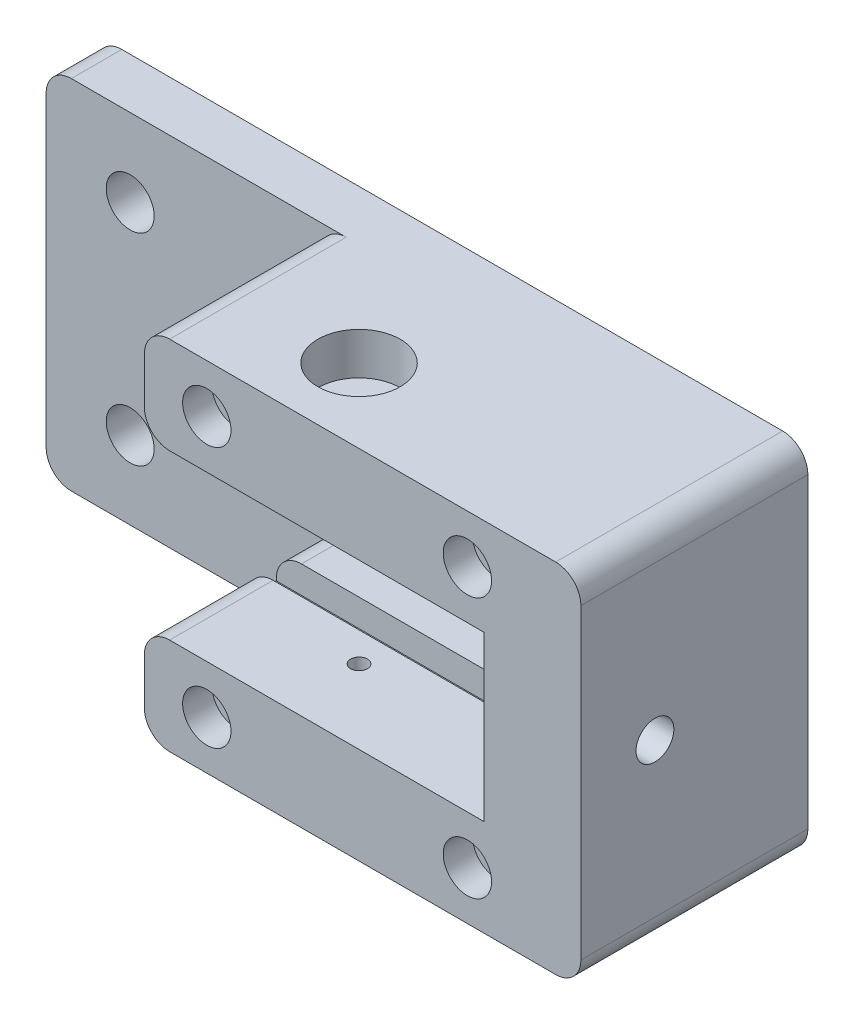
from build123d import *
from build123d.topology import SkipClean

# Parameters (mm, degrees)
SKETCH1_R           = 2.850000007
SKETCH1_R_2         = 1.725
BOSS_EXTRUDE1_DEPTH = 6
SKETCH7_R           = 11.125
CUT_EXTRUDE4_DEPTH  = 2.5
SKETCH8_R           = 7.5
CUT_EXTRUDE5_DEPTH  = 6
SKETCH10_R          = 1.725
BOSS_EXTRUDE4_DEPTH = 21
SKETCH11_W          = 3.38
SKETCH11_H          = 26
CUT_EXTRUDE6_DEPTH  = 40.422308
SKETCH14_R          = 1
CUT_EXTRUDE7_DEPTH  = 70.377273429
CHAMFER1_SIZE       = 3
SKETCH19_R          = 4.9
SKETCH19_R_2        = 1
CUT_EXTRUDE9_DEPTH  = 5
SKETCH20_R          = 2.125
CUT_EXTRUDE10_DEPTH = 3
SKETCH21_R          = 2.875
CUT_EXTRUDE11_DEPTH = 3.5
SKETCH22_R          = 2.25
CUT_EXTRUDE12_DEPTH = 82.036885127
CHAMFER5_SIZE       = 3


with BuildPart() as part:
    # Sketch1 → Boss-Extrude1 (new body)
    with BuildSketch(Plane.XY):
        with BuildLine():
            Line((-44.727938028, 20.301676915), (33.883013294, 20.301676915))
            ThreePointArc((33.883013294, 20.301676915), (36.004333638, 19.422997259), (36.883013294, 17.301676915))
            Line((36.883013294, 17.301676915), (36.883013294, -19.198323085))
            ThreePointArc((36.883013294, -19.198323085), (36.004333638, -21.319643428), (33.883013294, -22.198323085))
            Line((33.883013294, -22.198323085), (-44.727938028, -22.198323085))
            ThreePointArc((-44.727938028, -22.198323085), (-46.849258372, -21.319643428), (-47.727938028, -19.198323085))
            Line((-47.727938028, -19.198323085), (-47.727938028, 17.301676915))
            ThreePointArc((-47.727938028, 17.301676915), (-46.849258372, 19.422997259), (-44.727938028, 20.301676915))
        make_face()
        with Locations((-37.727938028, 11.051676915)):
            Circle(SKETCH1_R, mode=Mode.SUBTRACT)
        with Locations((-37.727938028, -12.948323085)):
            Circle(SKETCH1_R, mode=Mode.SUBTRACT)
        with Locations((-7.616986706, 14.551676915)):
            Circle(SKETCH1_R_2, mode=Mode.SUBTRACT)
        with Locations((-7.616986706, -16.448323085)):
            Circle(SKETCH1_R_2, mode=Mode.SUBTRACT)
        with Locations((23.383013294, -16.448323085)):
            Circle(SKETCH1_R_2, mode=Mode.SUBTRACT)
        with Locations((23.383013294, 14.551676915)):
            Circle(SKETCH1_R_2, mode=Mode.SUBTRACT)
    extrude(amount=BOSS_EXTRUDE1_DEPTH)

    # Sketch7 → Cut-Extrude4 (cut)
    with BuildSketch(Plane(origin=(0, 0, 0), x_dir=(-1, 0, 0), z_dir=(0, 0, -1))):
        with Locations((-7.883013294, -0.948323085)):
            Circle(SKETCH7_R)
    extrude(amount=-CUT_EXTRUDE4_DEPTH, mode=Mode.SUBTRACT)

    # Sketch8 → Cut-Extrude5 (cut)
    with BuildSketch(Plane(origin=(0, 0, 0), x_dir=(-1, 0, 0), z_dir=(0, 0, -1))):
        with Locations((-7.883013294, -0.948323085)):
            Circle(SKETCH8_R)
    extrude(amount=-CUT_EXTRUDE5_DEPTH, mode=Mode.SUBTRACT)

    # Sketch10 → Boss-Extrude4 (add)
    with BuildSketch(Plane.XY.offset(6)):
        with BuildLine():
            Line((-12.039294537, 20.301676915), (33.883013294, 20.301676915))
            ThreePointArc((33.883013294, 20.301676915), (36.004333638, 19.422997259), (36.883013294, 17.301676915))
            Line((36.883013294, 17.301676915), (36.883013294, -19.198323085))
            ThreePointArc((36.883013294, -19.198323085), (36.004333638, -21.319643428), (33.883013294, -22.198323085))
            Line((33.883013294, -22.198323085), (-12.039294537, -22.198323085))
            ThreePointArc((-12.039294537, -22.198323085), (-14.160614881, -21.319643428), (-15.039294537, -19.198323085))
            Line((-15.039294537, -19.198323085), (-15.039294537, -13.698323085))
            ThreePointArc((-15.039294537, -13.698323085), (-14.160614881, -11.577002741), (-12.039294537, -10.698323085))
            Line((-12.039294537, -10.698323085), (25.383013294, -10.698323085))
            Line((25.383013294, -10.698323085), (25.383013294, 8.801676915))
            Line((25.383013294, 8.801676915), (-12.039294537, 8.801676915))
            ThreePointArc((-12.039294537, 8.801676915), (-14.160614881, 9.680356572), (-15.039294537, 11.801676915))
            Line((-15.039294537, 11.801676915), (-15.039294537, 17.301676915))
            ThreePointArc((-15.039294537, 17.301676915), (-14.160614881, 19.422997259), (-12.039294537, 20.301676915))
        make_face()
        with Locations((-7.616986706, 14.551676915)):
            Circle(SKETCH10_R, mode=Mode.SUBTRACT)
        with Locations((23.383013294, 14.551676915)):
            Circle(SKETCH10_R, mode=Mode.SUBTRACT)
        with Locations((-7.616986706, -16.448323085)):
            Circle(SKETCH10_R, mode=Mode.SUBTRACT)
        with Locations((23.383013294, -16.448323085)):
            Circle(SKETCH10_R, mode=Mode.SUBTRACT)
    extrude(amount=BOSS_EXTRUDE4_DEPTH)

    # Sketch11 → Cut-Extrude6 (cut)
    with SkipClean():  # the faces are left unmerged after this step: merging them gives an invalid solid
        with BuildSketch(Plane.ZY.offset(15.039294537)):
            with Locations((13, -0.948323085)):
                Rectangle(SKETCH11_W, SKETCH11_H)
        extrude(amount=-CUT_EXTRUDE6_DEPTH, mode=Mode.SUBTRACT)

    # Sketch14 → Cut-Extrude7 (cut, through all)
    with SkipClean():  # the faces are left unmerged after this step: merging them gives an invalid solid
        with BuildSketch(Plane(origin=(0, 20.301676915, 0), x_dir=(1, 0, 0), z_dir=(0, 1, 0))):
            with Locations(Location((1.683013294, -18.19, 0), (0, 0, 270))):
                Circle(SKETCH14_R)
        extrude(amount=-CUT_EXTRUDE7_DEPTH, mode=Mode.SUBTRACT)

    # Chamfer1
    chamfer1_edges = [part.edges().sort_by_distance(p)[0] for p in [
        (1.683013294, -22.198323085, 17.19),
    ]]
    chamfer(chamfer1_edges, length=CHAMFER1_SIZE)

    # Sketch19 → Cut-Extrude9 (cut)
    with SkipClean():  # the faces are left unmerged after this step: merging them gives an invalid solid
        with BuildSketch(Plane(origin=(0, 20.301676915, 0), x_dir=(1, 0, 0), z_dir=(0, 1, 0))):
            with Locations(Location((1.683013294, -18.19, 0), (0, 0, 270))):
                Circle(SKETCH19_R)
            with Locations(Location((1.683013294, -18.19, 0), (0, 0, 270))):
                Circle(SKETCH19_R_2, mode=Mode.SUBTRACT)
        extrude(amount=-CUT_EXTRUDE9_DEPTH, mode=Mode.SUBTRACT)

    # Sketch20 → Cut-Extrude10 (cut)
    with SkipClean():  # the faces are left unmerged after this step: merging them gives an invalid solid
        with BuildSketch(Plane(origin=(0, 15.301676915, 0), x_dir=(1, 0, 0), z_dir=(0, 1, 0))):
            with Locations(Location((1.683013294, -18.19, 0), (0, 0, 270))):
                Circle(SKETCH20_R)
        extrude(amount=-CUT_EXTRUDE10_DEPTH, mode=Mode.SUBTRACT)

    # Sketch21 → Cut-Extrude11 (cut)
    with SkipClean():  # the faces are left unmerged after this step: merging them gives an invalid solid
        with BuildSketch(Plane.XY.offset(27)):
            with Locations((23.383013294, 14.551676915)):
                Circle(SKETCH21_R)
            with Locations((23.383013294, -16.448323085)):
                Circle(SKETCH21_R)
            with Locations((-7.616986706, -16.448323085)):
                Circle(SKETCH21_R)
            with Locations((-7.616986706, 14.551676915)):
                Circle(SKETCH21_R)
        extrude(amount=-CUT_EXTRUDE11_DEPTH, mode=Mode.SUBTRACT)

    # Sketch22 → Cut-Extrude12 (cut, through all)
    with SkipClean():  # the faces are left unmerged after this step: merging them gives an invalid solid
        with BuildSketch(Plane.ZY.offset(-25.383013294)):
            with Locations(Location((18.19, -0.948323085, 0), (0, 0, 270))):
                Circle(SKETCH22_R)
        extrude(amount=-CUT_EXTRUDE12_DEPTH, mode=Mode.SUBTRACT)

    # Chamfer5
    # the kernel refuses this chamfer: 3 mm, written as the material it takes off along each edge
    with BuildSketch(Plane(origin=(1.683013294, 8.801676915, 18.19), x_dir=(0, 0, 1), z_dir=(-1, 0, 0))) as chamfer5_piece_1:
        Polygon((1 + CHAMFER5_SIZE, 0), (1, CHAMFER5_SIZE), (1, 0), align=None)
    revolve(axis=Axis((1.683013294, 8.801676915, 18.19), (0, 1, 0)), mode=Mode.SUBTRACT)


solid = part.part
